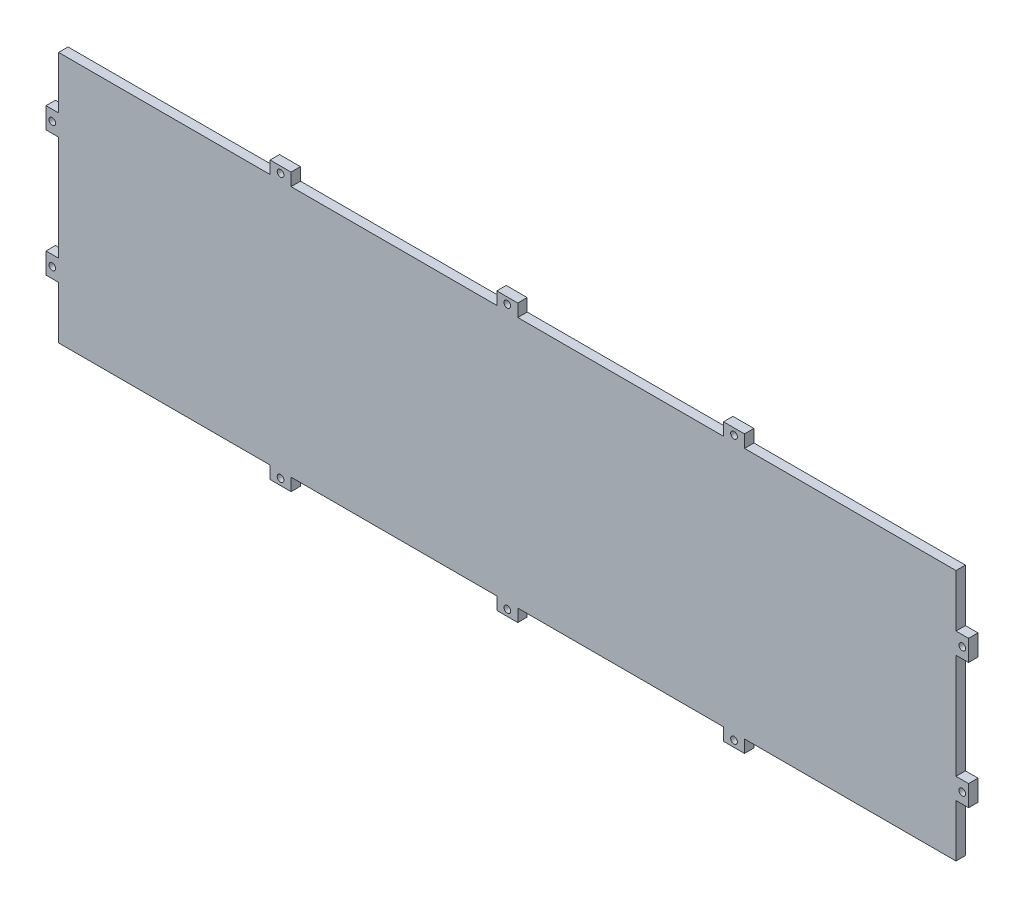
from build123d import *

# Parameters (mm, degrees)
SKETCH1_R           = 1.6
BOSS_EXTRUDE1_DEPTH = 4.5


with BuildPart() as part:
    # Sketch1 → Boss-Extrude1 (new body)
    with BuildSketch(Plane.XY):
        Polygon((6, 250), (106.875, 250), (106.875, 256), (116.875, 256), (116.875, 250), (215, 250), (215, 256), (225, 256), (225, 250), (323.125, 250), (323.125, 256), (333.125, 256), (333.125, 250), (434, 250), (434, 225), (440, 225), (440, 215), (434, 215), (434, 165), (440, 165), (440, 155), (434, 155), (434, 130), (333.125, 130), (333.125, 124), (323.125, 124), (323.125, 130), (225, 130), (225, 124), (215, 124), (215, 130), (116.875, 130), (116.875, 124), (106.875, 124), (106.875, 130), (6, 130), (6, 155), (0, 155), (0, 165), (6, 165), (6, 215), (0, 215), (0, 225), (6, 225), align=None)
        with Locations((111.875, 127)):
            Circle(SKETCH1_R, mode=Mode.SUBTRACT)
        with Locations((220, 127)):
            Circle(SKETCH1_R, mode=Mode.SUBTRACT)
        with Locations((328.125, 127)):
            Circle(SKETCH1_R, mode=Mode.SUBTRACT)
        with Locations((328.125, 253)):
            Circle(SKETCH1_R, mode=Mode.SUBTRACT)
        with Locations((220, 253)):
            Circle(SKETCH1_R, mode=Mode.SUBTRACT)
        with Locations((111.875, 253)):
            Circle(SKETCH1_R, mode=Mode.SUBTRACT)
        with Locations((3, 220)):
            Circle(SKETCH1_R, mode=Mode.SUBTRACT)
        with Locations((3, 160)):
            Circle(SKETCH1_R, mode=Mode.SUBTRACT)
        with Locations((437, 220)):
            Circle(SKETCH1_R, mode=Mode.SUBTRACT)
        with Locations((437, 160)):
            Circle(SKETCH1_R, mode=Mode.SUBTRACT)
    extrude(amount=-BOSS_EXTRUDE1_DEPTH)


solid = part.part
